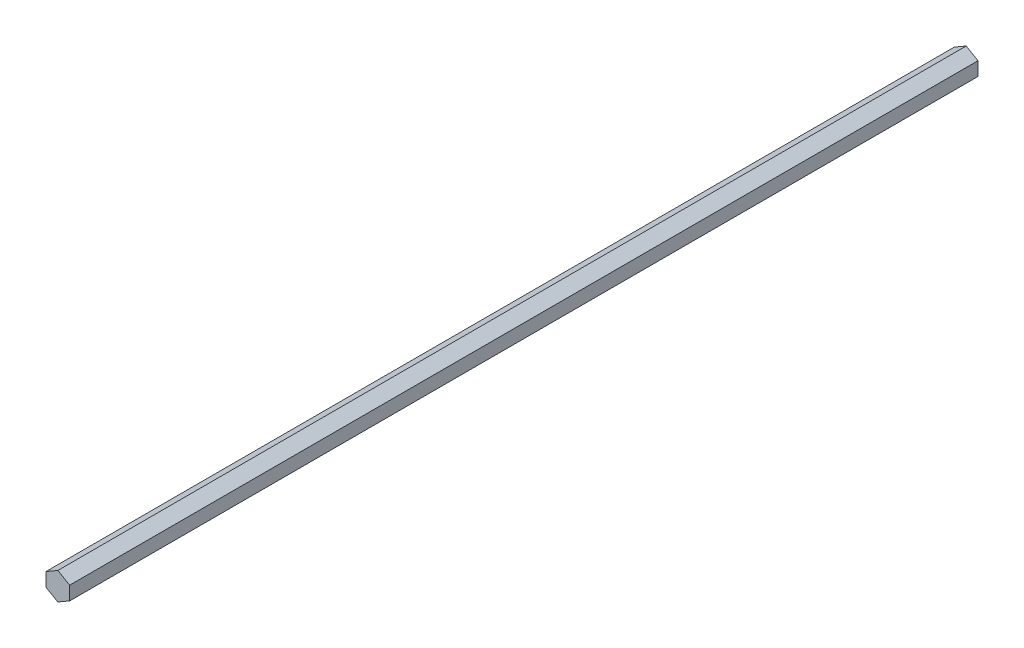
from build123d import *

# Parameters (mm, degrees)
BOSS_EXTRUDE1_DEPTH = 243.84


with BuildPart() as part:
    # Sketch3 → Boss-Extrude1 (new, symmetric)
    with BuildSketch(Plane.XY):
        Polygon((0, 7.332348419), (6.35, 3.666174209), (6.35, -3.666174209), (0, -7.332348419), (-6.35, -3.666174209), (-6.35, 3.666174209), align=None)
    extrude(amount=BOSS_EXTRUDE1_DEPTH, both=True)


solid = part.part
